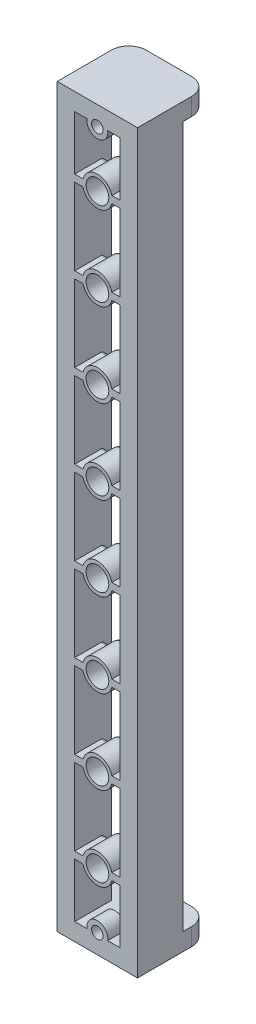
from build123d import *

# Parameters (mm, degrees)
SKETCH1_W              = 23
SKETCH1_H              = 211
SKETCH1_W_2            = 13
SKETCH1_H_2            = 201
BOSS_EXTRUDE1_DEPTH    = 13
SKETCH7_R              = 4.25
SKETCH7_R_2            = 3.25
SKETCH7_W              = 4
SKETCH7_H              = 2
BOSS_EXTRUDE5_DEPTH    = 8.5
FILLET4_R              = 1
LPATTERN7_COUNT        = 8
LPATTERN7_PITCH        = 24
FILLET4_OF_LPATTERN7_R = 1
SKETCH15_W             = 23
SKETCH15_H             = 13
BOSS_EXTRUDE8_DEPTH    = 5
SKETCH22_W             = 23
SKETCH22_H             = 5
CUT_EXTRUDE9_DEPTH     = 112.854816615
SKETCH23_W             = 23
SKETCH23_H             = 5
BOSS_EXTRUDE9_DEPTH    = 7.5
FILLET8_R              = 5
CUT_EXTRUDE11_START    = -5
CUT_EXTRUDE11_DEPTH    = 201
SKETCH26_R             = 3
BOSS_EXTRUDE10_DEPTH   = 5
SKETCH27_R             = 1.65
CUT_EXTRUDE12_DEPTH    = 109.086770698


with BuildPart() as part:
    # Sketch1 → Boss-Extrude1 (new body)
    with BuildSketch(Plane.XY):
        Rectangle(SKETCH1_W, SKETCH1_H)
        Rectangle(SKETCH1_W_2, SKETCH1_H_2, mode=Mode.SUBTRACT)
    extrude(amount=BOSS_EXTRUDE1_DEPTH)

    # Sketch7 → Boss-Extrude5 (add)
    # profile 1 of 3: a face of its own
    with BuildSketch(Plane.XY.offset(13)):
        with Locations((0.023652706, 84)):
            Circle(SKETCH7_R)
        with Locations((0.023652706, 84)):
            Circle(SKETCH7_R_2, mode=Mode.SUBTRACT)
    # profile 2 of 3: a face of its own
    with BuildSketch(Plane.XY.offset(13)):
        with Locations((-5.395766476, 84)):
            Rectangle(SKETCH7_W, SKETCH7_H)
    # profile 3 of 3: a face of its own
    with BuildSketch(Plane.XY.offset(13)):
        with Locations((5.443071887, 84)):
            Rectangle(SKETCH7_W, SKETCH7_H)
    boss_extrude5 = extrude(amount=-BOSS_EXTRUDE5_DEPTH)

    # Fillet4
    fillet4_edges = [part.edges().sort_by_distance(p)[0] for p in [
        (-5.303512602, 83, 4.5),
        (5.327165308, 85, 4.5),
        (-5.303512602, 85, 4.5),
        (0.023652706, 88.25, 4.5),
        (5.327165308, 83, 4.5),
        (0.023652706, 79.75, 4.5),
    ]]
    fillet(fillet4_edges, radius=FILLET4_R - 0.0001)  # a hair under: the kernel refuses the full size

    # LPattern7: Boss-Extrude5 ×8
    with Locations(*[(0, -i * LPATTERN7_PITCH, 0) for i in range(1, LPATTERN7_COUNT)]):
        add(boss_extrude5)

    # Fillet4 of LPattern7
    fillet4_of_lpattern7_edges = [part.edges().sort_by_distance(p)[0] for p in [
        (-5.303512602, 59, 4.5),
        (5.327165308, 61, 4.5),
        (-5.303512602, 61, 4.5),
        (0.023652706, 64.25, 4.5),
        (5.327165308, 59, 4.5),
        (0.023652706, 55.75, 4.5),
        (-5.303512602, 35, 4.5),
        (5.327165308, 37, 4.5),
        (-5.303512602, 37, 4.5),
        (0.023652706, 40.25, 4.5),
        (5.327165308, 35, 4.5),
        (0.023652706, 31.75, 4.5),
        (-5.303512602, 11, 4.5),
        (5.327165308, 13, 4.5),
        (-5.303512602, 13, 4.5),
        (0.023652706, 16.25, 4.5),
        (5.327165308, 11, 4.5),
        (0.023652706, 7.75, 4.5),
        (-5.303512602, -13, 4.5),
        (5.327165308, -11, 4.5),
        (-5.303512602, -11, 4.5),
        (0.023652706, -7.75, 4.5),
        (5.327165308, -13, 4.5),
        (0.023652706, -16.25, 4.5),
        (-5.303512602, -37, 4.5),
        (5.327165308, -35, 4.5),
        (-5.303512602, -35, 4.5),
        (0.023652706, -31.75, 4.5),
        (5.327165308, -37, 4.5),
        (0.023652706, -40.25, 4.5),
        (-5.303512602, -61, 4.5),
        (5.327165308, -59, 4.5),
        (-5.303512602, -59, 4.5),
        (0.023652706, -55.75, 4.5),
        (5.327165308, -61, 4.5),
        (0.023652706, -64.25, 4.5),
        (-5.303512602, -85, 4.5),
        (5.327165308, -83, 4.5),
        (-5.303512602, -83, 4.5),
        (0.023652706, -79.75, 4.5),
        (5.327165308, -85, 4.5),
        (0.023652706, -88.25, 4.5),
    ]]
    fillet(fillet4_of_lpattern7_edges, radius=FILLET4_OF_LPATTERN7_R - 0.0001)  # a hair under: the kernel refuses the full size

    # Sketch15 → Boss-Extrude8 (add)
    with BuildSketch(Plane(origin=(0, 105.5, 0), x_dir=(1, 0, 0), z_dir=(0, 1, 0))):
        with Locations((0, -6.5)):
            Rectangle(SKETCH15_W, SKETCH15_H)
    boss_extrude8 = extrude(amount=BOSS_EXTRUDE8_DEPTH)

    # Mirror5: Boss-Extrude8 across plane
    add(boss_extrude8.mirror(Plane.ZX))

    # Sketch22 → Cut-Extrude9 (cut, through all)
    with BuildSketch(Plane(origin=(0, 0, 0), x_dir=(-1, 0, 0), z_dir=(0, 0, -1))):
        with Locations((0, 108)):
            Rectangle(SKETCH22_W, SKETCH22_H)
        with Locations((0, -108)):
            Rectangle(SKETCH22_W, SKETCH22_H)
    extrude(amount=-CUT_EXTRUDE9_DEPTH, mode=Mode.SUBTRACT)

    # Sketch23 → Boss-Extrude9 (add)
    with BuildSketch(Plane(origin=(0, 0, 0), x_dir=(-1, 0, 0), z_dir=(0, 0, -1))):
        with Locations((0, 103)):
            Rectangle(SKETCH23_W, SKETCH23_H)
        with Locations((0, -103)):
            Rectangle(SKETCH23_W, SKETCH23_H)
    extrude(amount=BOSS_EXTRUDE9_DEPTH)

    # Fillet8
    fillet8_edges = [part.edges().sort_by_distance(p)[0] for p in [
        (11.5, 103, -7.5),
        (-11.5, 103, -7.5),
        (11.5, -103, -7.5),
        (-11.5, -103, -7.5),
    ]]
    fillet(fillet8_edges, radius=FILLET8_R)

    # Sketch25 → Cut-Extrude11 (cut)
    with BuildSketch(Plane.XZ.offset(105.5).offset(CUT_EXTRUDE11_START)):
        with BuildLine():
            Line((-9, -0.5), (-6, -0.5))
            Line((-6, -0.5), (-6, 2.5))
            ThreePointArc((-6, 2.5), (-8.121320344, 1.621320344), (-9, -0.5))
        make_face()
        with BuildLine():
            Line((6, -0.5), (6, 2.5))
            ThreePointArc((6, 2.5), (8.121320344, 1.621320344), (9, -0.5))
            Line((9, -0.5), (6, -0.5))
        make_face()
    extrude(amount=-CUT_EXTRUDE11_DEPTH, mode=Mode.SUBTRACT)

    # Sketch26 → Boss-Extrude10 (add)
    with BuildSketch(Plane.XY.offset(13)):
        with Locations((0, -100)):
            Circle(SKETCH26_R)
        with Locations((0, 100)):
            Circle(SKETCH26_R)
    extrude(amount=-BOSS_EXTRUDE10_DEPTH)

    # Sketch27 → Cut-Extrude12 (cut, through all)
    with BuildSketch(Plane.XY.offset(13)):
        with Locations((0, -100)):
            Circle(SKETCH27_R)
        with Locations((0, 100)):
            Circle(SKETCH27_R)
    extrude(amount=-CUT_EXTRUDE12_DEPTH, mode=Mode.SUBTRACT)


solid = part.part
